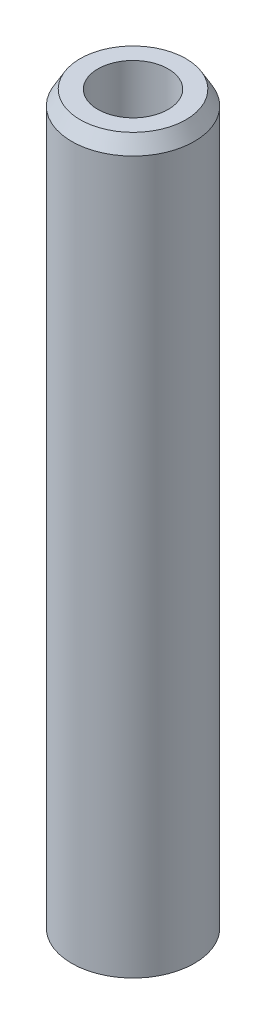
from build123d import *
from OCP.BRepFilletAPI import BRepFilletAPI_MakeChamfer

# Parameters (mm, degrees)
SKETCH1_R           = 7.5
BOSS_EXTRUDE1_DEPTH = 89.838116211
SKETCH2_R           = 4.298993134
CUT_EXTRUDE1_DEPTH  = 91.462075614
CHAMFER1_SIZE       = 1.784415546
CHAMFER1_SIZE2      = 1.030232796


with BuildPart() as part:
    # Sketch1 → Boss-Extrude1 (new body)
    with BuildSketch(Plane(origin=(0, 0, 0), x_dir=(1, 0, 0), z_dir=(0, 1, 0))):
        Circle(SKETCH1_R)
    extrude(amount=BOSS_EXTRUDE1_DEPTH)

    # Sketch2 → Cut-Extrude1 (cut, through all)
    with BuildSketch(Plane(origin=(0, 0, 0), x_dir=(1, 0, 0), z_dir=(0, 1, 0))):
        Circle(SKETCH2_R)
    extrude(amount=CUT_EXTRUDE1_DEPTH, mode=Mode.SUBTRACT)

    # Chamfer1: one chamfer whose edges measure the first distance from different faces: ONE call of the kernel's chamfer builder (chamfer() names one face for all edges)
    chamfer1_edges_1 = [part.edges().sort_by_distance(p)[0] for p in [
        (-7.5, 89.838116211, 0),
    ]]
    chamfer1_side_1 = [part.faces().sort_by_distance(p)[0] for p in [
        (-7.5, 44.919058105, 0),
    ]]
    chamfer1_edges_2 = [part.edges().sort_by_distance(p)[0] for p in [
        (-7.5, 0, 0),
    ]]
    chamfer1_side_2 = [part.faces().sort_by_distance(p)[0] for p in [
        (-7.287867966, 0, 0),
    ]]
    chamfer1 = BRepFilletAPI_MakeChamfer(part.part.solid().wrapped)
    for e in chamfer1_edges_1:
        chamfer1.Add(CHAMFER1_SIZE, CHAMFER1_SIZE2, e.wrapped, chamfer1_side_1[0].wrapped)  # the first distance lies on this face
    for e in chamfer1_edges_2:
        chamfer1.Add(CHAMFER1_SIZE, CHAMFER1_SIZE2, e.wrapped, chamfer1_side_2[0].wrapped)  # the first distance lies on this face
    add(Compound.cast(chamfer1.Shape()), mode=Mode.REPLACE)


solid = part.part
